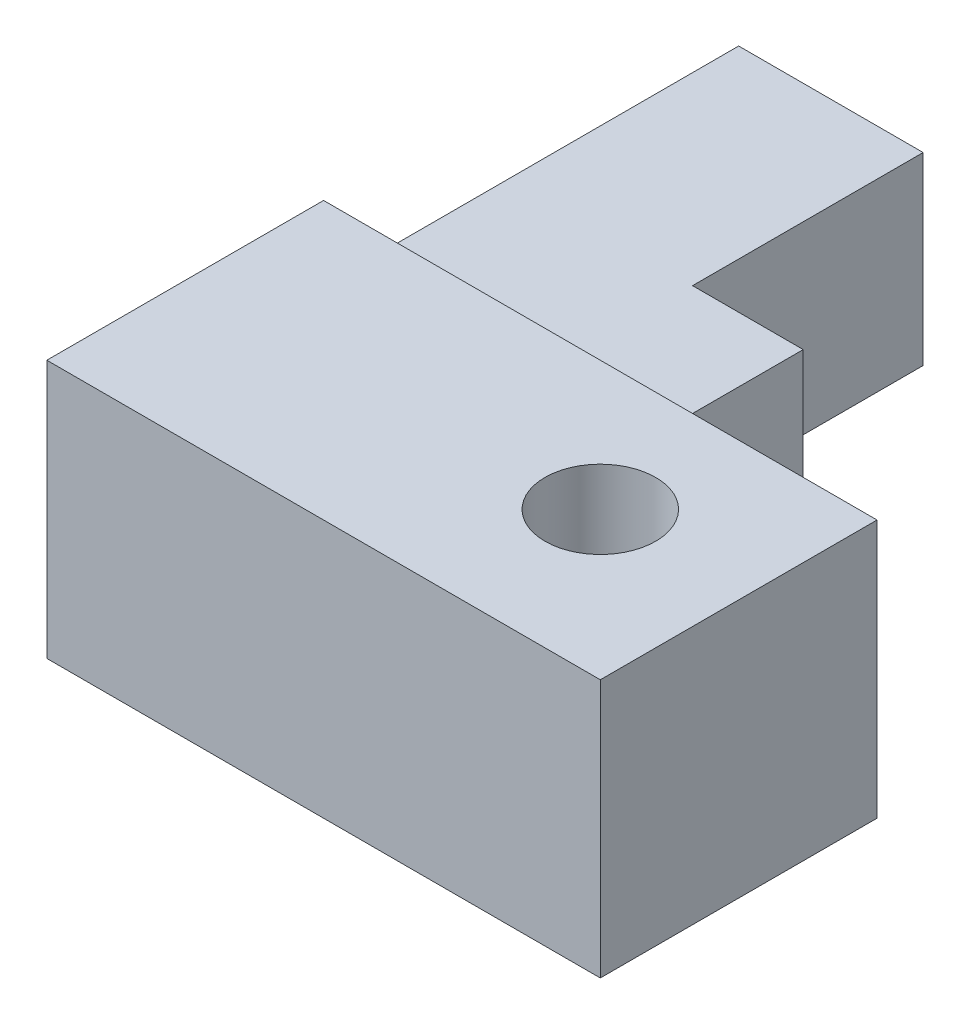
from build123d import *

# Parameters (mm, degrees)
SKETCH1_R           = 6
BOSS_EXTRUDE1_DEPTH = 20
SKETCH1_3_R         = 6
BOSS_EXTRUDE2_DEPTH = 28


with BuildPart() as part:
    # Sketch1 → Boss-Extrude1 (new body)
    with BuildSketch(Plane(origin=(0, 0, 0), x_dir=(1, 0, 0), z_dir=(0, 1, 0))):
        Polygon((0, 0), (60, 0), (60, 30), (48, 30), (48, 38), (32, 38), (32, 50), (20, 50), (20, 75), (0, 75), align=None)
        with Locations((44, 16)):
            Circle(SKETCH1_R, mode=Mode.SUBTRACT)
    extrude(amount=BOSS_EXTRUDE1_DEPTH)

    # Sketch1<3> → Boss-Extrude2 (add)
    with BuildSketch(Plane(origin=(0, 0, 0), x_dir=(1, 0, 0), z_dir=(0, 1, 0))):
        Polygon((0, 30), (0, 0), (60, 0), (60, 30), (48, 30), align=None)
        with Locations((44, 16)):
            Circle(SKETCH1_3_R, mode=Mode.SUBTRACT)
    extrude(amount=BOSS_EXTRUDE2_DEPTH)


solid = part.part
